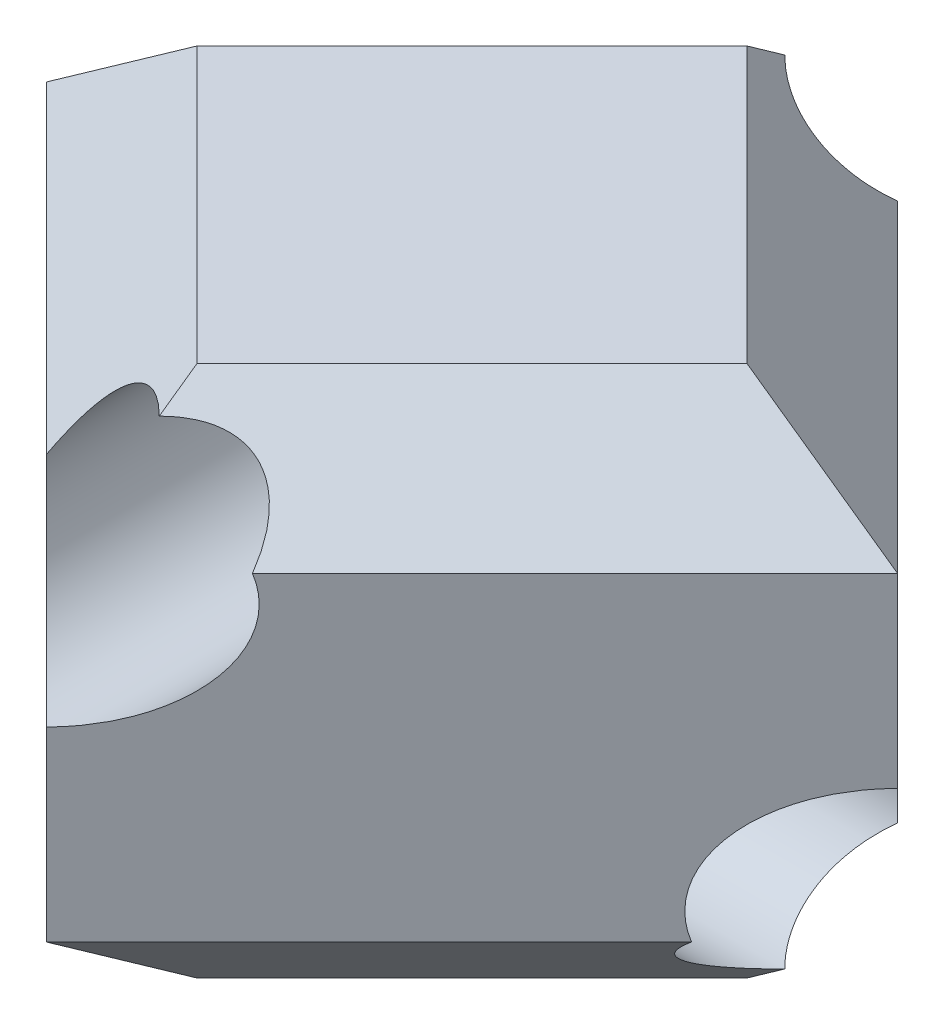
from build123d import *

# Parameters (mm, degrees)
EXTRUDE_1_DEPTH          = 25
CUT_EXTRUDE_2_DEPTH      = 52.23475383
CUT_EXTRUDE_2_DEPTH_BACK = 52.23475383
SKETCH_2_R               = 5
CUT_EXTRUDE_3_DEPTH      = 52.23475383
CUT_EXTRUDE_3_DEPTH_BACK = 52.23475383
SKETCH_3_R               = 5
CHAMFER_1_SIZE           = 5


with BuildPart() as part:
    # 草圖1 → 填料-伸長1 (new body)
    with BuildSketch(Plane(origin=(0, 0, 0), x_dir=(1, 0, 0), z_dir=(0, 1, 0))):
        Polygon((0, 0), (20, 20), (40, 0), (20, -20), align=None)
    extrude(amount=EXTRUDE_1_DEPTH)

    # 草圖2 → 除料-伸長2 (cut, two sides: drawn at the far end of the back side and taken through both)
    with BuildSketch(Plane(origin=(0, 0, 0), x_dir=(0, 0, -1), z_dir=(1, 0, 0)).offset(-CUT_EXTRUDE_2_DEPTH_BACK)):
        with Locations(Location((0, 6.25, 0), (0, 0, 270.000068755))):
            Circle(SKETCH_2_R)
    extrude(amount=CUT_EXTRUDE_2_DEPTH + CUT_EXTRUDE_2_DEPTH_BACK, mode=Mode.SUBTRACT)

    # 草圖3 → 除料-伸長3 (cut, two sides: drawn at the far end of the back side and taken through both)
    with BuildSketch(Plane.XY.offset(-CUT_EXTRUDE_3_DEPTH_BACK)):
        with Locations(Location((20, 18.75, 0), (0, 0, 90))):
            Circle(SKETCH_3_R)
    extrude(amount=CUT_EXTRUDE_3_DEPTH + CUT_EXTRUDE_3_DEPTH_BACK, mode=Mode.SUBTRACT)

    # 導角1
    # the kernel refuses this chamfer: 5 mm, written as the material it takes off along each edge
    with BuildSketch(Plane(origin=(49.092272399, 0, -9.092272399), x_dir=(0.01944252080601414, 0.9996219169112968, 0.01944252080601414), z_dir=(-0.7071067811865476, 0, 0.7071067811865476)), Plane(origin=(10.907727601, 0, -29.092272399), x_dir=(0.019442520806014316, 0.9996219169112968, -0.01944252080601431), z_dir=(0.7071067811865475, 0, 0.7071067811865476)), Plane(origin=(-9.092272399, 0, 9.092272399), x_dir=(-0.01944252080601397, 0.9996219169112968, -0.019442520806013965), z_dir=(0.7071067811865475, 0, -0.7071067811865476)), Plane(origin=(29.092272399, 0, 29.092272399), x_dir=(-0.019442520806014486, 0.9996219169112968, 0.019442520806014486), z_dir=(-0.7071067811865476, 0, -0.7071067811865476)), Plane(origin=(10.907727601, 25, -29.092272399), x_dir=(-0.7068394360706736, 0.027495876610586313, 0.7068394360706735), z_dir=(0.7071067811865475, 0, 0.7071067811865476))) as chamfer_1_piece_1:
        Polygon((CHAMFER_1_SIZE * 0.999621916911, CHAMFER_1_SIZE * 0.0274958766106), (-CHAMFER_1_SIZE * 0.0274958766106, CHAMFER_1_SIZE * 0.999621916911), (0, 0), align=None)
    extrude(amount=54.001101127, mode=Mode.SUBTRACT)
    with BuildSketch(Plane(origin=(29.092272399, 25, 29.092272399), x_dir=(-0.019442520806014486, -0.9996219169112968, 0.019442520806014486), z_dir=(-0.7071067811865476, 0, -0.7071067811865476)), Plane(origin=(-9.092272399, 25, 9.092272399), x_dir=(-0.01944252080601397, -0.9996219169112968, -0.019442520806013965), z_dir=(0.7071067811865475, 0, -0.7071067811865476)), Plane(origin=(49.092272399, 25, -9.092272399), x_dir=(0.01944252080601414, -0.9996219169112968, 0.01944252080601414), z_dir=(-0.7071067811865476, 0, 0.7071067811865476))) as chamfer_1_piece_2:
        Polygon((CHAMFER_1_SIZE * 0.999621916911, -CHAMFER_1_SIZE * 0.0274958766106), (-CHAMFER_1_SIZE * 0.0274958766106, -CHAMFER_1_SIZE * 0.999621916911), (0, 0), align=None)
    extrude(amount=54.001101127, mode=Mode.SUBTRACT)


solid = part.part
